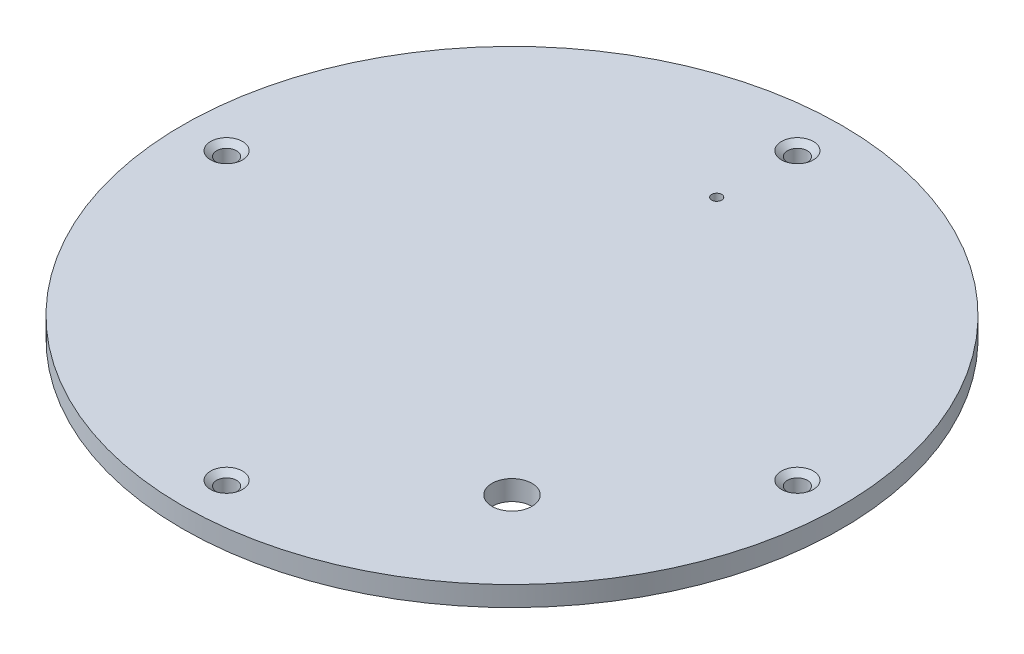
from build123d import *

# Parameters (mm, degrees)
SKETCH1_R                                       = 16.5
BOSS_EXTRUDE1_DEPTH                             = 1
CUT_EXTRUDE1_DEPTH                              = 24.355941428
CUT_EXTRUDE1_DEPTH_BACK                         = 24.355941428
SKETCH6_R                                       = 0.25
SKETCH6_R_2                                     = 1
CSK_FOR_M2_FLAT_HEAD_MACHINE_SCREW1_D           = 1
CSK_FOR_M2_FLAT_HEAD_MACHINE_SCREW1_CSINK_D     = 1.6
CSK_FOR_M2_FLAT_HEAD_MACHINE_SCREW1_CSINK_ANGLE = 100


with BuildPart() as part:
    # Sketch1 → Boss-Extrude1 (new body)
    with BuildSketch(Plane(origin=(0, 0, 0), x_dir=(1, 0, 0), z_dir=(0, 1, 0))):
        Circle(SKETCH1_R)
    extrude(amount=BOSS_EXTRUDE1_DEPTH)

    # Sketch6 → Cut-Extrude1 (cut, two sides: drawn at the far end of the back side and taken through both)
    with BuildSketch(Plane(origin=(0, 1, 0), x_dir=(1, 0, 0), z_dir=(0, 1, 0)).offset(-CUT_EXTRUDE1_DEPTH_BACK)):
        with Locations((0, 10.25)):
            Circle(SKETCH6_R)
        with Locations((7.778174593, -7.778174593)):
            Circle(SKETCH6_R_2)
    extrude(amount=CUT_EXTRUDE1_DEPTH + CUT_EXTRUDE1_DEPTH_BACK, mode=Mode.SUBTRACT)

    # CSK for M2 Flat Head Machine Screw1 (through all)
    with Locations(Plane(origin=(0, 1, 0), x_dir=(1, 0, 0), z_dir=(0, 1, 0))):
        with Locations((0, 14.29), (-14.29, 0), (0, -14.29), (14.29, 0)):
            CounterSinkHole(CSK_FOR_M2_FLAT_HEAD_MACHINE_SCREW1_D / 2, CSK_FOR_M2_FLAT_HEAD_MACHINE_SCREW1_CSINK_D / 2, counter_sink_angle=CSK_FOR_M2_FLAT_HEAD_MACHINE_SCREW1_CSINK_ANGLE)


solid = part.part
